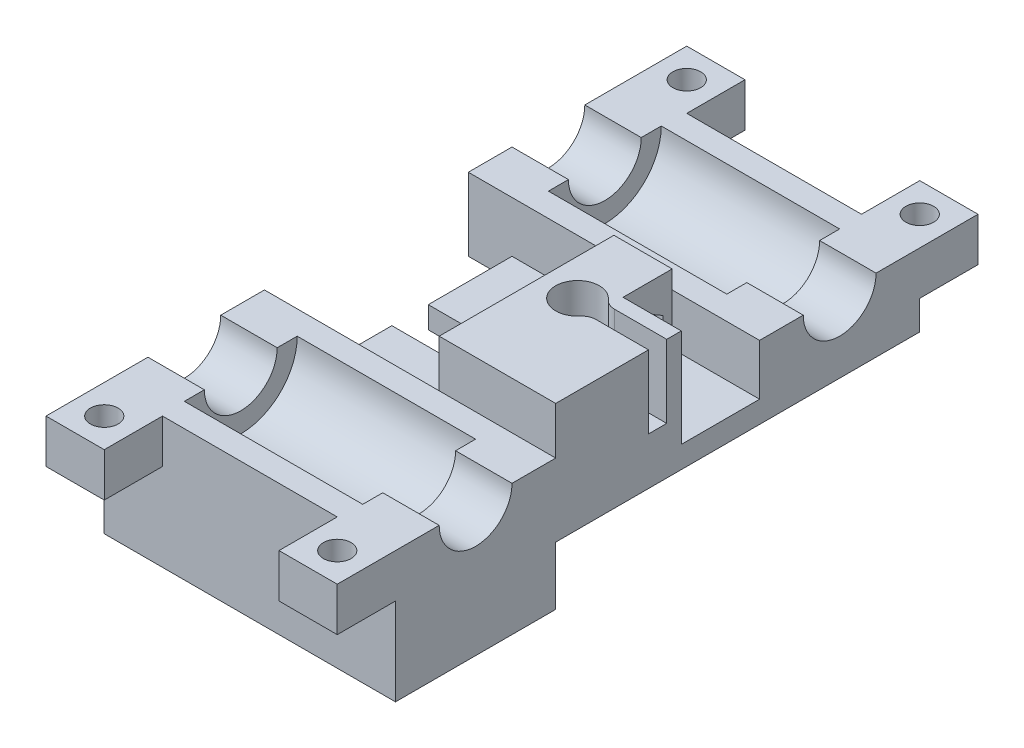
from build123d import *

# Parameters (mm, degrees)
SKETCH1_W                  = 40
SKETCH1_H                  = 22
BOSS_EXTRUDE1_DEPTH        = 11
SKETCH2_W                  = 40
SKETCH2_H                  = 22
SKETCH2_R                  = 4.25
BOSS_EXTRUDE2_DEPTH        = 7
SKETCH3_W                  = 24.5
SKETCH3_H                  = 15.5
CUT_EXTRUDE1_DEPTH         = 7.75
FILLET1_R                  = 7.75
SKETCH4_R                  = 5
CUT_EXTRUDE2_DEPTH         = 36.805900352
SKETCH5_W                  = 8
SKETCH5_H                  = 8
SKETCH5_R                  = 1.905800151
BOSS_EXTRUDE3_DEPTH        = 6
CUT_EXTRUDE3_START         = -3
SKETCH6_R                  = 3
SKETCH6_R_2                = 1.905800151
CUT_EXTRUDE3_DEPTH         = 3
SKETCH7_W                  = 16
SKETCH7_H                  = 16.5
BOSS_EXTRUDE5_DEPTH        = 28
MIRROR14_COPY_1_SKETCH_W   = 8
MIRROR14_COPY_1_SKETCH_H   = 8
MIRROR14_COPY_1_SKETCH_R   = 1.905800151
MIRROR14_COPY_1_DEPTH      = 6
MIRROR14_START             = -3
MIRROR14_COPY_2_SKETCH_R   = 3
MIRROR14_COPY_2_SKETCH_R_2 = 1.905800151
MIRROR14_COPY_2_DEPTH      = 3
FILLET1_OF_MIRROR14_R      = 7.75
SKETCH9_W                  = 28
SKETCH9_H                  = 3
BOSS_EXTRUDE6_DEPTH        = 18
CUT_EXTRUDE4_DEPTH         = 10
CUT_EXTRUDE5_DEPTH         = 74.288812243
CUT_EXTRUDE5_DEPTH_BACK    = 74.288812243
SKETCH11_R                 = 1.75
CUT_EXTRUDE6_DEPTH         = 76.121568141
CUT_EXTRUDE6_DEPTH_BACK    = 76.121568141
SKETCH12_R                 = 1.75
FILLET2_R                  = 2
CUT_EXTRUDE12_START        = -3
SKETCH17_R                 = 1.75
CUT_EXTRUDE12_DEPTH        = 3
CUT_EXTRUDE13_DEPTH        = 74.097537578
CUT_EXTRUDE13_DEPTH_BACK   = 74.097537578
SKETCH18_W                 = 18
SKETCH18_H                 = 5
FILLET3_R                  = 2.5
CUT_EXTRUDE14_DEPTH        = 74.710582687
CUT_EXTRUDE15_START        = -10
SKETCH21_R                 = 1.75
CUT_EXTRUDE15_DEPTH        = 10
SKETCH20_W                 = 36.163748027
SKETCH20_H                 = 4
CUT_EXTRUDE16_DEPTH        = 13.5
SKETCH22_W                 = 6.75
SKETCH22_H                 = 13.5
CUT_EXTRUDE18_DEPTH        = 8
SKETCH23_R                 = 4.25
BOSS_EXTRUDE8_DEPTH        = 1


with BuildPart() as part:
    # Sketch1 → Boss-Extrude1 (new body)
    with BuildSketch(Plane(origin=(0, 0, 0), x_dir=(1, 0, 0), z_dir=(0, 1, 0))):
        Rectangle(SKETCH1_W, SKETCH1_H)
    boss_extrude1 = extrude(amount=BOSS_EXTRUDE1_DEPTH)

    # Sketch2 → Boss-Extrude2 (add)
    with BuildSketch(Plane(origin=(0, 0, 0), x_dir=(1, 0, 0), z_dir=(0, 1, 0))):
        Rectangle(SKETCH2_W, SKETCH2_H)
        with Locations(Location((0, 0, 0), (0, 0, 270))):
            Circle(SKETCH2_R, mode=Mode.SUBTRACT)
    boss_extrude2 = extrude(amount=-BOSS_EXTRUDE2_DEPTH)

    # Sketch3 → Cut-Extrude1 (cut)
    with BuildSketch(Plane(origin=(0, 11, 0), x_dir=(1, 0, 0), z_dir=(0, 1, 0))):
        Rectangle(SKETCH3_W, SKETCH3_H)
    cut_extrude1 = extrude(amount=-CUT_EXTRUDE1_DEPTH, mode=Mode.SUBTRACT)

    # Fillet1
    fillet1_edges = [part.edges().sort_by_distance(p)[0] for p in [
        (0, 3.25, 7.75),
        (0, 3.25, -7.75),
    ]]
    fillet(fillet1_edges, radius=FILLET1_R - 0.0001)  # a hair under: the kernel refuses the full size

    # Sketch4 → Cut-Extrude2 (cut, symmetric)
    with BuildSketch(Plane(origin=(-12.25, 0, 0), x_dir=(0, 0, -1), z_dir=(1, 0, 0))):
        with Locations((0, 11)):
            Circle(SKETCH4_R)
    cut_extrude2 = extrude(amount=CUT_EXTRUDE2_DEPTH, both=True, mode=Mode.SUBTRACT)

    # Sketch5 → Boss-Extrude3 (add)
    with BuildSketch(Plane(origin=(0, 11, 0), x_dir=(1, 0, 0), z_dir=(0, 1, 0))):
        with Locations((16, -15)):
            Rectangle(SKETCH5_W, SKETCH5_H)
        with Locations(Location((16, -15, 0), (0, 0, 270))):
            Circle(SKETCH5_R, mode=Mode.SUBTRACT)
    boss_extrude3 = extrude(amount=-BOSS_EXTRUDE3_DEPTH)

    # Sketch6 → Cut-Extrude3 (cut)
    with BuildSketch(Plane.XZ.offset(-5).offset(CUT_EXTRUDE3_START)):
        with Locations(Location((16, 15, 0), (0, 0, 270))):
            Circle(SKETCH6_R)
        with Locations(Location((16, 15, 0), (0, 0, 90))):
            Circle(SKETCH6_R_2, mode=Mode.SUBTRACT)
    cut_extrude3 = extrude(amount=CUT_EXTRUDE3_DEPTH, mode=Mode.SUBTRACT)

    # Mirror8: Boss-Extrude3, Cut-Extrude3 across plane
    add(boss_extrude3.mirror(Plane(origin=(0, 0, 0), x_dir=(0, 0, 1), z_dir=(1, 0, 0))))
    add(cut_extrude3.mirror(Plane(origin=(0, 0, 0), x_dir=(0, 0, 1), z_dir=(1, 0, 0))), mode=Mode.SUBTRACT)

    # Sketch7 → Boss-Extrude5 (add)
    with BuildSketch(Plane(origin=(0, 0, -11), x_dir=(-1, 0, 0), z_dir=(0, 0, -1))):
        with Locations((-12, 9.25)):
            Rectangle(SKETCH7_W, SKETCH7_H)
    extrude(amount=BOSS_EXTRUDE5_DEPTH)

    # Mirror14: Boss-Extrude1, Boss-Extrude2, Cut-Extrude1, Cut-Extrude2, Boss-Extrude3, Cut-Extrude3 across plane
    add(boss_extrude1.mirror(Plane.XY.offset(-25)))
    add(boss_extrude2.mirror(Plane.XY.offset(-25)))
    add(cut_extrude1.mirror(Plane.XY.offset(-25)), mode=Mode.SUBTRACT)
    add(cut_extrude2.mirror(Plane.XY.offset(-25)), mode=Mode.SUBTRACT)
    add(boss_extrude3.mirror(Plane.XY.offset(-25)))
    add(cut_extrude3.mirror(Plane.XY.offset(-25)), mode=Mode.SUBTRACT)

    # Mirror14 copy 1 sketch → Mirror14 copy 1 (add)
    with BuildSketch(Plane(origin=(0, 11, -50), x_dir=(-1, 0, 0), z_dir=(0, 1, 0))):
        with Locations((16, -15)):
            Rectangle(MIRROR14_COPY_1_SKETCH_W, MIRROR14_COPY_1_SKETCH_H)
        with Locations(Location((16, -15, 0), (0, 0, 270))):
            Circle(MIRROR14_COPY_1_SKETCH_R, mode=Mode.SUBTRACT)
    extrude(amount=-MIRROR14_COPY_1_DEPTH)

    # Mirror14 copy 2 sketch → Mirror14 copy 2 (cut)
    with BuildSketch(Plane(origin=(0, 5, -50), x_dir=(-1, 0, 0), z_dir=(0, -1, 0)).offset(MIRROR14_START)):
        with Locations(Location((16, 15, 0), (0, 0, 270))):
            Circle(MIRROR14_COPY_2_SKETCH_R)
        with Locations(Location((16, 15, 0), (0, 0, 90))):
            Circle(MIRROR14_COPY_2_SKETCH_R_2, mode=Mode.SUBTRACT)
    extrude(amount=MIRROR14_COPY_2_DEPTH, mode=Mode.SUBTRACT)

    # Fillet1 of Mirror14
    fillet1_of_mirror14_edges = [part.edges().sort_by_distance(p)[0] for p in [
        (0, 3.25, -57.75),
        (0, 3.25, -42.25),
    ]]
    fillet(fillet1_of_mirror14_edges, radius=FILLET1_OF_MIRROR14_R - 0.0001)  # a hair under: the kernel refuses the full size

    # Sketch9 → Boss-Extrude6 (add)
    with BuildSketch(Plane.ZY.offset(-4)):
        with Locations((-25, 2.5)):
            Rectangle(SKETCH9_W, SKETCH9_H)
    extrude(amount=BOSS_EXTRUDE6_DEPTH)

    # Sketch10 → Cut-Extrude4 (cut)
    with BuildSketch(Plane(origin=(0, 17.5, 0), x_dir=(1, 0, 0), z_dir=(0, 1, 0))):
        with BuildLine():
            Line((9, 26.25), (9, 23.75))
            Line((9, 23.75), (11.727178029, 23.75))
            ThreePointArc((11.727178029, 23.75), (11.931001031, 24.360286817), (12, 25))
            ThreePointArc((12, 25), (11.931001031, 25.639713183), (11.727178029, 26.25))
            Line((11.727178029, 26.25), (9, 26.25))
        make_face()
        with BuildLine():
            Line((11.727178029, 23.75), (9, 23.75))
            Line((9, 23.75), (9, 26.25))
            Line((9, 26.25), (11.727178029, 26.25))
            ThreePointArc((11.727178029, 26.25), (6, 25), (11.727178029, 23.75))
        make_face()
        with BuildLine():
            ThreePointArc((12, 25), (11.931001031, 24.360286817), (11.727178029, 23.75))
            Line((11.727178029, 23.75), (20, 23.75))
            Line((20, 23.75), (20, 26.25))
            Line((20, 26.25), (11.727178029, 26.25))
            ThreePointArc((11.727178029, 26.25), (11.931001031, 25.639713183), (12, 25))
        make_face()
    extrude(amount=-CUT_EXTRUDE4_DEPTH, mode=Mode.SUBTRACT)

    # Sketch11 → Cut-Extrude5 (cut, two sides: drawn at the far end of the back side and taken through both)
    with BuildSketch(Plane(origin=(0, 7.5, 0), x_dir=(1, 0, 0), z_dir=(0, 1, 0)).offset(-CUT_EXTRUDE5_DEPTH_BACK)):
        with Locations(Location((9, 25, 0), (0, 0, 270))):
            Circle(SKETCH11_R)
    extrude(amount=CUT_EXTRUDE5_DEPTH + CUT_EXTRUDE5_DEPTH_BACK, mode=Mode.SUBTRACT)

    # Sketch12 → Cut-Extrude6 (cut, two sides: drawn at the far end of the back side and taken through both)
    with BuildSketch(Plane.ZY.offset(-4).offset(-CUT_EXTRUDE6_DEPTH_BACK)):
        with Locations((-31, 11)):
            Circle(SKETCH12_R)
    extrude(amount=CUT_EXTRUDE6_DEPTH + CUT_EXTRUDE6_DEPTH_BACK, mode=Mode.SUBTRACT)

    # Fillet2
    fillet2_edges = [part.edges().sort_by_distance(p)[0] for p in [
        (11.727178029, 12.5, -23.75),
        (11.727178029, 12.5, -26.25),
    ]]
    fillet(fillet2_edges, radius=FILLET2_R)

    # Sketch17 → Cut-Extrude12 (cut)
    with BuildSketch(Plane.XZ.offset(-1).offset(CUT_EXTRUDE12_START)):
        Polygon((12.175426481, -25), (10.58771324, -22.25), (7.41228676, -22.25), (5.824573519, -25), (7.41228676, -27.75), (10.58771324, -27.75), align=None)
        with Locations(Location((9, -25, 0), (0, 0, 90))):
            Circle(SKETCH17_R, mode=Mode.SUBTRACT)
    extrude(amount=CUT_EXTRUDE12_DEPTH, mode=Mode.SUBTRACT)

    # Sketch18 → Cut-Extrude13 (cut, two sides: drawn at the far end of the back side and taken through both)
    with BuildSketch(Plane(origin=(0, 4, 0), x_dir=(1, 0, 0), z_dir=(0, 1, 0)).offset(-CUT_EXTRUDE13_DEPTH_BACK)):
        with Locations((-5, 25)):
            Rectangle(SKETCH18_W, SKETCH18_H)
    extrude(amount=CUT_EXTRUDE13_DEPTH + CUT_EXTRUDE13_DEPTH_BACK, mode=Mode.SUBTRACT)

    # Fillet3
    fillet3_edges = [part.edges().sort_by_distance(p)[0] for p in [
        (4, 2.5, -27.5),
        (4, 2.5, -22.5),
    ]]
    fillet(fillet3_edges, radius=FILLET3_R - 0.0001)  # a hair under: the kernel refuses the full size

    # Sketch19 → Cut-Extrude14 (cut, through all)
    with BuildSketch(Plane.XZ.offset(-1)):
        Polygon((20, -61), (20, -39), (-14, -39), (-20, -39), (-20, -61), align=None)
    extrude(amount=CUT_EXTRUDE14_DEPTH, mode=Mode.SUBTRACT)

    # Sketch21 → Cut-Extrude15 (cut)
    with BuildSketch(Plane(origin=(20, 0, 0), x_dir=(0, 0, -1), z_dir=(1, 0, 0)).offset(CUT_EXTRUDE15_START)):
        Polygon((31, 14.175426481), (28.25, 12.58771324), (28.25, 9.41228676), (31, 7.824573519), (33.75, 9.41228676), (33.75, 12.58771324), align=None)
        with Locations((31, 11)):
            Circle(SKETCH21_R, mode=Mode.SUBTRACT)
    extrude(amount=CUT_EXTRUDE15_DEPTH, mode=Mode.SUBTRACT)

    # Sketch20 → Cut-Extrude16 (cut)
    with BuildSketch(Plane(origin=(0, 17.5, 0), x_dir=(1, 0, 0), z_dir=(0, 1, 0))):
        with Locations((22.081874014, 37)):
            Rectangle(SKETCH20_W, SKETCH20_H)
    extrude(amount=-CUT_EXTRUDE16_DEPTH, mode=Mode.SUBTRACT)

    # Sketch22 → Cut-Extrude18 (cut)
    with BuildSketch(Plane(origin=(20, 0, 0), x_dir=(0, 0, -1), z_dir=(1, 0, 0))):
        with Locations((31.625, 10.75)):
            Rectangle(SKETCH22_W, SKETCH22_H)
    extrude(amount=-CUT_EXTRUDE18_DEPTH, mode=Mode.SUBTRACT)

    # Sketch23 → Boss-Extrude8 (add)
    with BuildSketch(Plane.XZ):
        with Locations(Location((0, 0, 0), (0, 0, 90))):
            Circle(SKETCH23_R)
    extrude(amount=BOSS_EXTRUDE8_DEPTH)


solid = part.part
